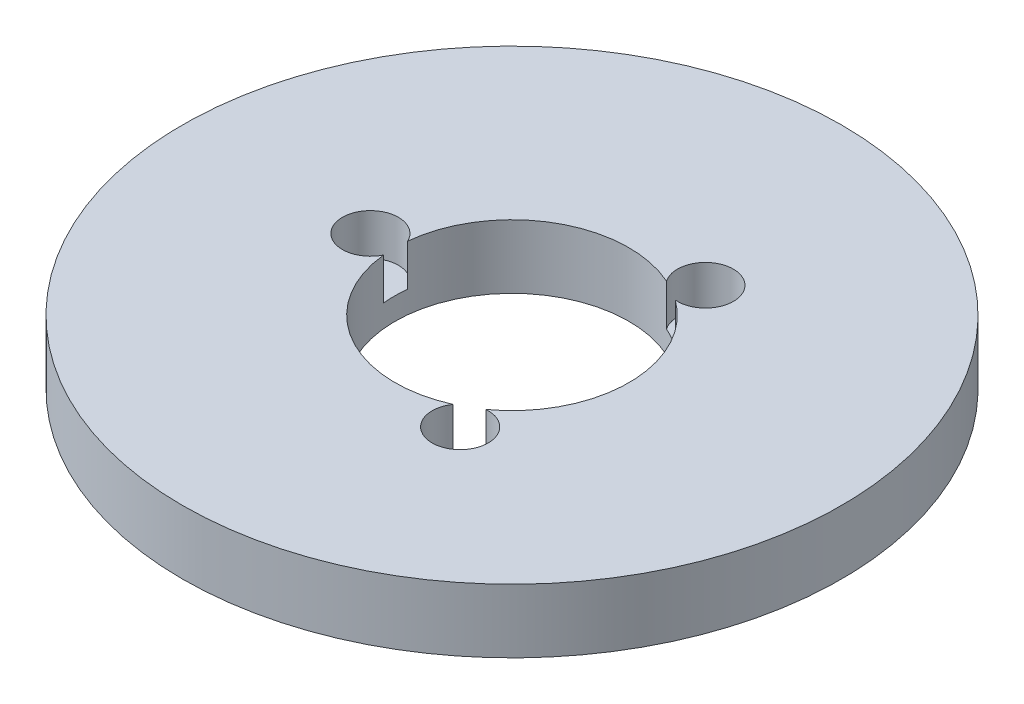
from build123d import *

# Parameters (mm, degrees)
SKETCH1_R           = 77.5
BOSS_EXTRUDE1_DEPTH = 15
SKETCH2_R           = 27.5
CUT_EXTRUDE1_DEPTH  = 111.623234449
SKETCH3_R           = 6.581326796
CUT_EXTRUDE2_DEPTH  = 9.773935142
CIRPATTERN1_COUNT   = 3


with BuildPart() as part:
    # Sketch1 → Boss-Extrude1 (new body)
    with BuildSketch(Plane(origin=(0, 0, 0), x_dir=(1, 0, 0), z_dir=(0, 1, 0))):
        Circle(SKETCH1_R)
    extrude(amount=BOSS_EXTRUDE1_DEPTH)

    # Sketch2 → Cut-Extrude1 (cut, through all)
    with BuildSketch(Plane(origin=(0, 0, 0), x_dir=(1, 0, 0), z_dir=(0, 1, 0))):
        Circle(SKETCH2_R)
    extrude(amount=CUT_EXTRUDE1_DEPTH, mode=Mode.SUBTRACT)

    # Sketch3 → Cut-Extrude2 (cut)
    with BuildSketch(Plane(origin=(0, 15, 0), x_dir=(1, 0, 0), z_dir=(0, 1, 0))):
        with Locations((-33.296273578, 0)):
            Circle(SKETCH3_R)
    cut_extrude2 = extrude(amount=-CUT_EXTRUDE2_DEPTH, mode=Mode.SUBTRACT)

    # CirPattern1: Cut-Extrude2 ×3 about axis
    cirpattern1_axis = Axis((0, 0, 0), (0, 1, 0))
    for i in range(1, CIRPATTERN1_COUNT):
        add(cut_extrude2.rotate(cirpattern1_axis, i * 360 / CIRPATTERN1_COUNT), mode=Mode.SUBTRACT)


solid = part.part
